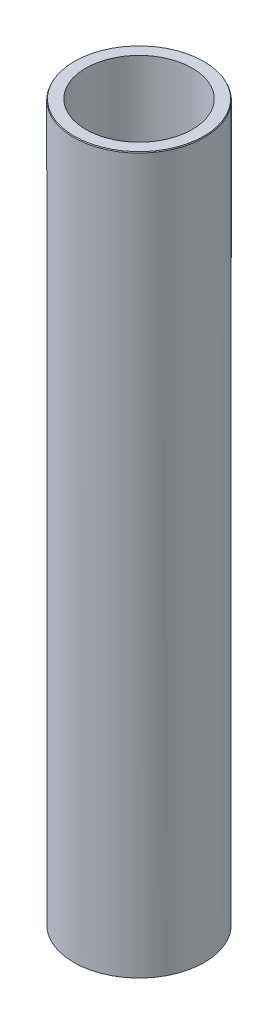
from build123d import *
from OCP.BRepFilletAPI import BRepFilletAPI_MakeChamfer

# Parameters (mm, degrees)
SKETCH1_R           = 42.5
BOSS_EXTRUDE1_DEPTH = 466.056655496
SKETCH2_R           = 34.648441443
CUT_EXTRUDE1_DEPTH  = 470.916275662
CHAMFER1_SIZE       = 0.571666647
CHAMFER1_SIZE2      = 0.330051892


with BuildPart() as part:
    # Sketch1 → Boss-Extrude1 (new body)
    with BuildSketch(Plane(origin=(0, 0, 0), x_dir=(1, 0, 0), z_dir=(0, 1, 0))):
        Circle(SKETCH1_R)
    extrude(amount=BOSS_EXTRUDE1_DEPTH)

    # Sketch2 → Cut-Extrude1 (cut, through all)
    with BuildSketch(Plane(origin=(0, 0, 0), x_dir=(1, 0, 0), z_dir=(0, 1, 0))):
        Circle(SKETCH2_R)
    extrude(amount=CUT_EXTRUDE1_DEPTH, mode=Mode.SUBTRACT)

    # Chamfer1: one chamfer whose edges measure the first distance from different faces: ONE call of the kernel's chamfer builder (chamfer() names one face for all edges)
    chamfer1_edges_1 = [part.edges().sort_by_distance(p)[0] for p in [
        (-42.5, 466.056655496, 0),
    ]]
    chamfer1_side_1 = [part.faces().sort_by_distance(p)[0] for p in [
        (-42.5, 233.028327748, 0),
    ]]
    chamfer1_edges_2 = [part.edges().sort_by_distance(p)[0] for p in [
        (-42.5, 0, 0),
    ]]
    chamfer1_side_2 = [part.faces().sort_by_distance(p)[0] for p in [
        (-41.297918472, 0, 0),
    ]]
    chamfer1 = BRepFilletAPI_MakeChamfer(part.part.solid().wrapped)
    for e in chamfer1_edges_1:
        chamfer1.Add(CHAMFER1_SIZE, CHAMFER1_SIZE2, e.wrapped, chamfer1_side_1[0].wrapped)  # the first distance lies on this face
    for e in chamfer1_edges_2:
        chamfer1.Add(CHAMFER1_SIZE, CHAMFER1_SIZE2, e.wrapped, chamfer1_side_2[0].wrapped)  # the first distance lies on this face
    add(Compound.cast(chamfer1.Shape()), mode=Mode.REPLACE)


solid = part.part
